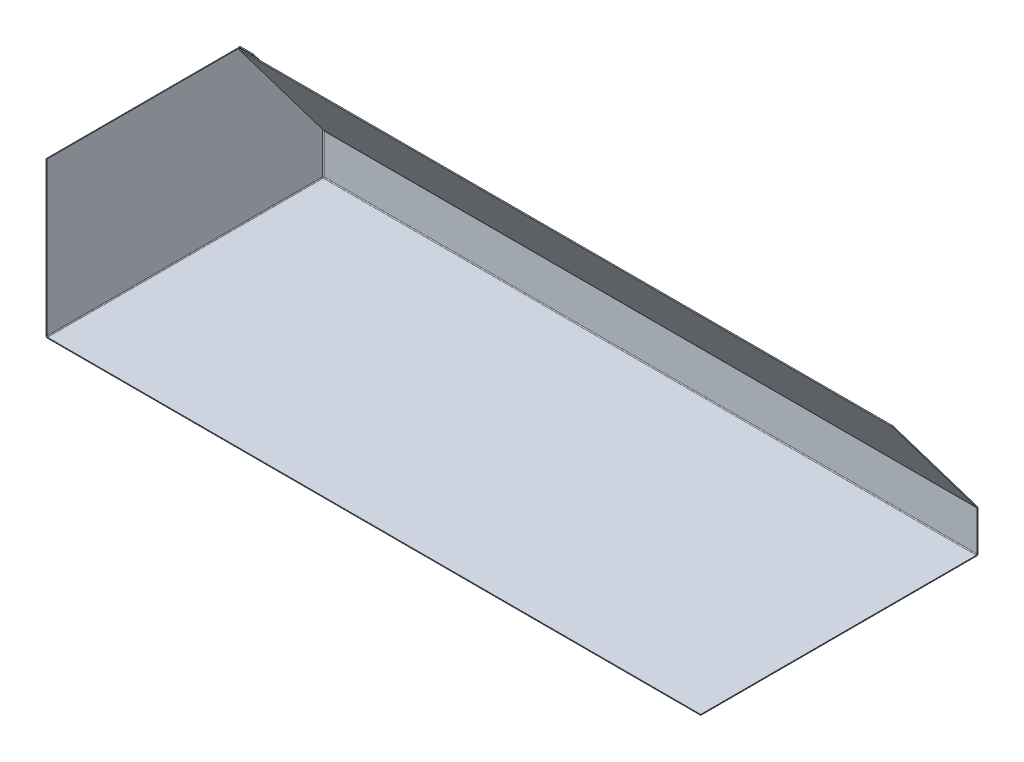
from build123d import *

# Parameters (mm, degrees)
SKETCH2_W                    = 254
SKETCH2_H                    = 0.7366
BASE_FLANGE1_DEPTH           = 600
EDGE_FLANGE1_STRIP_W         = 4.4196
EDGE_FLANGE1_STRIP_H         = 0.7366
EDGE_FLANGE1_STRIP_CUT_DEPTH = 600
EDGE_FLANGE1_DEPTH           = 600
EDGE_FLANGE2_STRIP_CUT_DEPTH = 600
EDGE_FLANGE2_DEPTH           = 600
EDGE_FLANGE3_DEPTH           = 253.2634
CUT_EXTRUDE1_DEPTH           = 669.329179279
EDGE_FLANGE4_DEPTH           = 127.552071744


# Sheet-metal steps are written as plain solids
with BuildPart() as part:
    # Sketch2 → Base-Flange1 (new body)
    with BuildSketch(Plane(origin=(0, 0, 0), x_dir=(0, 0, -1), z_dir=(1, 0, 0))):
        with Locations((127, -0.3683)):
            Rectangle(SKETCH2_W, SKETCH2_H)
    extrude(amount=BASE_FLANGE1_DEPTH)

    # Edge-Flange1 strip (across the edge) → Edge-Flange1 strip cut (cut)
    with BuildSketch(Plane(origin=(600, 0, -254), x_dir=(0, 0, 1), z_dir=(-1, 0, 0))):
        with Locations((-1.4732, -0.3683)):
            Rectangle(EDGE_FLANGE1_STRIP_W, EDGE_FLANGE1_STRIP_H)
    extrude(amount=EDGE_FLANGE1_STRIP_CUT_DEPTH, mode=Mode.SUBTRACT)

    # Edge-Flange1 section (across the edge) → Edge-Flange1 (add)
    with BuildSketch(Plane(origin=(600, 0, -254), x_dir=(0, 0, 1), z_dir=(-1, 0, 0))):
        with BuildLine():
            Line((-0.7366, 0.7366), (-0.7366, 37.3634))
            Line((-0.7366, 37.3634), (0, 37.3634))
            Line((0, 37.3634), (0, 0.7366))
            ThreePointArc((0, 0.7366), (0.215745145, 0.215745145), (0.7366, 0))
            Line((0.7366, 0), (0.7366, -0.7366))
            ThreePointArc((0.7366, -0.7366), (-0.30510971, -0.30510971), (-0.7366, 0.7366))
        make_face()
    extrude(amount=EDGE_FLANGE1_DEPTH)

    # Edge-Flange2 strip (across the edge) → Edge-Flange2 strip cut (cut)
    with BuildSketch(Plane(origin=(600, 37.3634, -254), x_dir=(0, -0.6018150231520416, 0.7986355100472979), z_dir=(-1, 0, 0))):
        Polygon((-3.09973151, 2.88951852), (-0.439949833, -0.64013098), (0.148325083, -0.196834034), (-2.511456593, 3.332815466), align=None)
    extrude(amount=EDGE_FLANGE2_STRIP_CUT_DEPTH, mode=Mode.SUBTRACT)

    # Edge-Flange2 section (across the edge) → Edge-Flange2 (add)
    with BuildSketch(Plane(origin=(600, 37.3634, -254), x_dir=(0, -0.6018150231520416, 0.7986355100472979), z_dir=(-1, 0, 0))):
        with BuildLine():
            Line((-0.7366, 0.246462912), (-0.7366, 129.753537088))
            Line((-0.7366, 129.753537088), (0, 129.753537088))
            Line((0, 129.753537088), (0, 0.246462912))
            ThreePointArc((0, 0.246462912), (0.038064796, 0.012736302), (0.148325083, -0.196834034))
            Line((0.148325083, -0.196834034), (-0.439949833, -0.64013098))
            ThreePointArc((-0.439949833, -0.64013098), (-0.660470409, -0.220990307), (-0.7366, 0.246462912))
        make_face()
    extrude(amount=EDGE_FLANGE2_DEPTH)

    # Edge-Flange3 section (across the edge) → Edge-Flange3 (add)
    with BuildSketch(Plane(origin=(-0.7366, 0, -253.2634), x_dir=(1, 0, 0), z_dir=(0, 0, 1))):
        with BuildLine():
            Line((-0.7366, 0.7366), (-0.7366, 141.432479218))
            Line((-0.7366, 141.432479218), (0, 141.432479218))
            Line((0, 141.432479218), (0, 0.7366))
            ThreePointArc((0, 0.7366), (0.215745145, 0.215745145), (0.7366, 0))
            Line((0.7366, 0), (0.7366, -0.7366))
            ThreePointArc((0.7366, -0.7366), (-0.30510971, -0.30510971), (-0.7366, 0.7366))
        make_face()
    extrude(amount=EDGE_FLANGE3_DEPTH)

    # Sketch16 → Cut-Extrude1 (cut, through all)
    with BuildSketch(Plane.ZY.offset(1.4732)):
        Polygon((-254.439949833, 38.00353098), (-176.50064699, 141.432479218), (-254.439949833, 141.432479218), align=None)
    extrude(amount=-CUT_EXTRUDE1_DEPTH, mode=Mode.SUBTRACT)

    # Edge-Flange4 section (across the edge) → Edge-Flange4 (add)
    with BuildSketch(Plane(origin=(-0.7366, 40.00816229, -253.851674917), x_dir=(5.5927072616139335e-15, -0.6018150231520416, 0.7986355100472979), z_dir=(-2.7888745978675463e-15, 0.7986355100472979, 0.6018150231520416))):
        with BuildLine():
            Line((-0.7366, 0.7366), (-0.7366, 11.9634))
            Line((-0.7366, 11.9634), (0, 11.9634))
            Line((0, 11.9634), (0, 0.7366))
            ThreePointArc((0, 0.7366), (0.215745145, 0.215745145), (0.7366, 0))
            Line((0.7366, 0), (0.7366, -0.7366))
            ThreePointArc((0.7366, -0.7366), (-0.30510971, -0.30510971), (-0.7366, 0.7366))
        make_face()
    extrude(amount=EDGE_FLANGE4_DEPTH)


solid = part.part
